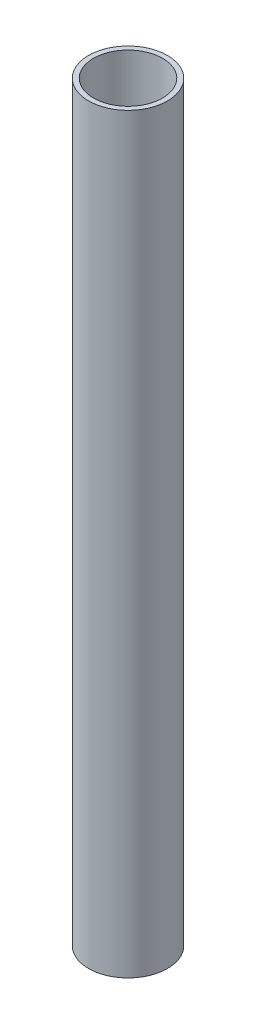
from build123d import *

# Parameters (mm, degrees)
SKETCH1_R           = 4
SKETCH1_R_2         = 3.5
BOSS_EXTRUDE1_DEPTH = 76.2


with BuildPart() as part:
    # Sketch1 → Boss-Extrude1 (new body)
    with BuildSketch(Plane(origin=(0, 0, 0), x_dir=(1, 0, 0), z_dir=(0, 1, 0))):
        Circle(SKETCH1_R)
        Circle(SKETCH1_R_2, mode=Mode.SUBTRACT)
    extrude(amount=BOSS_EXTRUDE1_DEPTH)


solid = part.part
